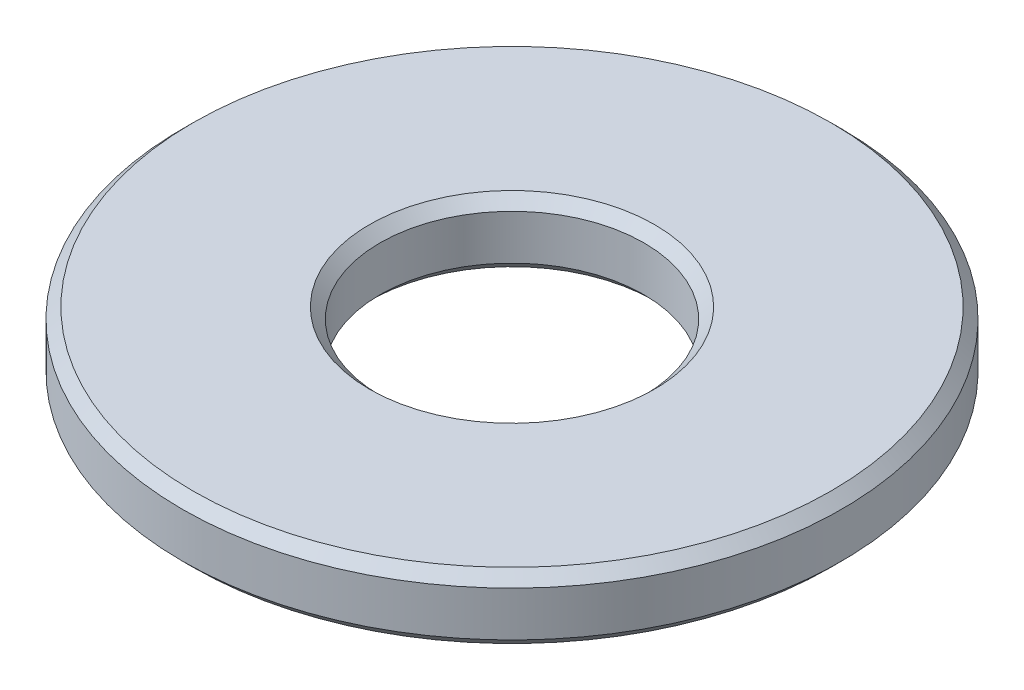
from build123d import *

# Parameters (mm, degrees)
SKETCH1_W     = 2.3749
SKETCH1_H     = 0.79375
CHAMFER1_SIZE = 0.127


with BuildPart() as part:
    # Sketch1 → Revolve1 (revolve)
    with BuildSketch(Plane.XY):
        with Locations((2.77495, 0)):
            Rectangle(SKETCH1_W, SKETCH1_H)
    revolve(axis=Axis((0, 3.40958908, 0), (0, -1, 0)))

    # Chamfer1
    chamfer1_edges = [part.edges().sort_by_distance(p)[0] for p in [
        (-3.9624, -0.396875, 0),
        (-3.9624, 0.396875, 0),
        (-1.5875, 0.396875, 0),
        (-1.5875, -0.396875, 0),
    ]]
    chamfer(chamfer1_edges, length=CHAMFER1_SIZE)


solid = part.part
